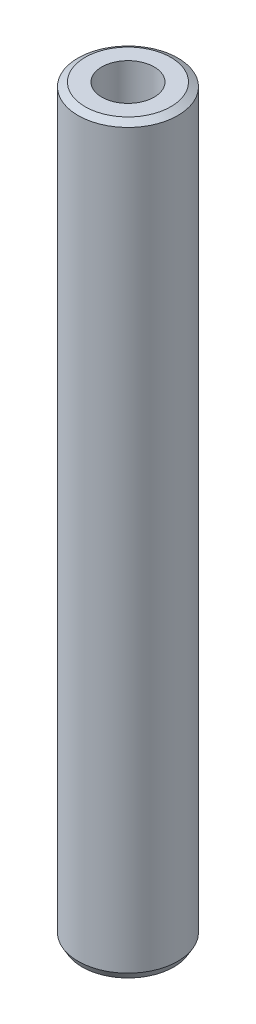
from build123d import *
from OCP.BRepFilletAPI import BRepFilletAPI_MakeChamfer

# Parameters (mm, degrees)
SKETCH1_R           = 20
BOSS_EXTRUDE1_DEPTH = 298.061542419
SKETCH2_R           = 10.506515886
CUT_EXTRUDE1_DEPTH  = 300.400539527
CHAMFER1_SIZE       = 1.635703082
CHAMFER1_SIZE2      = 2.833120844


with BuildPart() as part:
    # Sketch1 → Boss-Extrude1 (new body)
    with BuildSketch(Plane(origin=(0, 0, 0), x_dir=(1, 0, 0), z_dir=(0, 1, 0))):
        Circle(SKETCH1_R)
    extrude(amount=BOSS_EXTRUDE1_DEPTH)

    # Sketch2 → Cut-Extrude1 (cut, through all)
    with BuildSketch(Plane(origin=(0, 0, 0), x_dir=(1, 0, 0), z_dir=(0, 1, 0))):
        Circle(SKETCH2_R)
    extrude(amount=CUT_EXTRUDE1_DEPTH, mode=Mode.SUBTRACT)

    # Chamfer1: one chamfer whose edges measure the first distance from different faces: ONE call of the kernel's chamfer builder (chamfer() names one face for all edges)
    chamfer1_edges_1 = [part.edges().sort_by_distance(p)[0] for p in [
        (-20, 298.061542419, 0),
    ]]
    chamfer1_side_1 = [part.faces().sort_by_distance(p)[0] for p in [
        (-20, 149.030771209, 0),
    ]]
    chamfer1_edges_2 = [part.edges().sort_by_distance(p)[0] for p in [
        (-20, 0, 0),
    ]]
    chamfer1_side_2 = [part.faces().sort_by_distance(p)[0] for p in [
        (-19.434314575, 0, 0),
    ]]
    chamfer1 = BRepFilletAPI_MakeChamfer(part.part.solid().wrapped)
    for e in chamfer1_edges_1:
        chamfer1.Add(CHAMFER1_SIZE, CHAMFER1_SIZE2, e.wrapped, chamfer1_side_1[0].wrapped)  # the first distance lies on this face
    for e in chamfer1_edges_2:
        chamfer1.Add(CHAMFER1_SIZE, CHAMFER1_SIZE2, e.wrapped, chamfer1_side_2[0].wrapped)  # the first distance lies on this face
    add(Compound.cast(chamfer1.Shape()), mode=Mode.REPLACE)


solid = part.part
